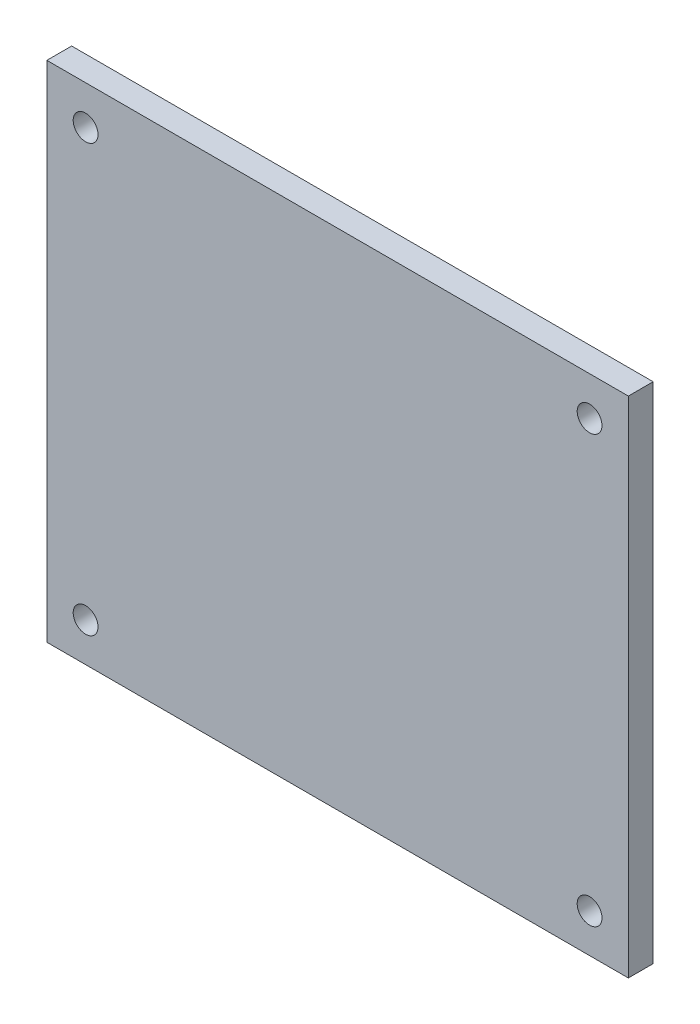
from build123d import *

# Parameters (mm, degrees)
SKETCH1_W                  = 75
SKETCH1_H                  = 65
BASE_FLANGE1_DEPTH         = 3.2
F_3_2_3_2_DIAMETER_HOLE1_D = 3.2


# Sheet-metal steps are written as plain solids
with BuildPart() as part:
    # Sketch1 → Base-Flange1 (new body)
    with BuildSketch(Plane.XY):
        Rectangle(SKETCH1_W, SKETCH1_H)
    extrude(amount=-BASE_FLANGE1_DEPTH)

    # Ø3.2 (3.2) Diameter Hole1 (through all)
    with Locations(Plane.XY):
        with Locations((-32.5, 27.5), (-32.5, -27.5), (32.5, -27.5), (32.5, 27.5)):
            Hole(F_3_2_3_2_DIAMETER_HOLE1_D / 2)


solid = part.part
